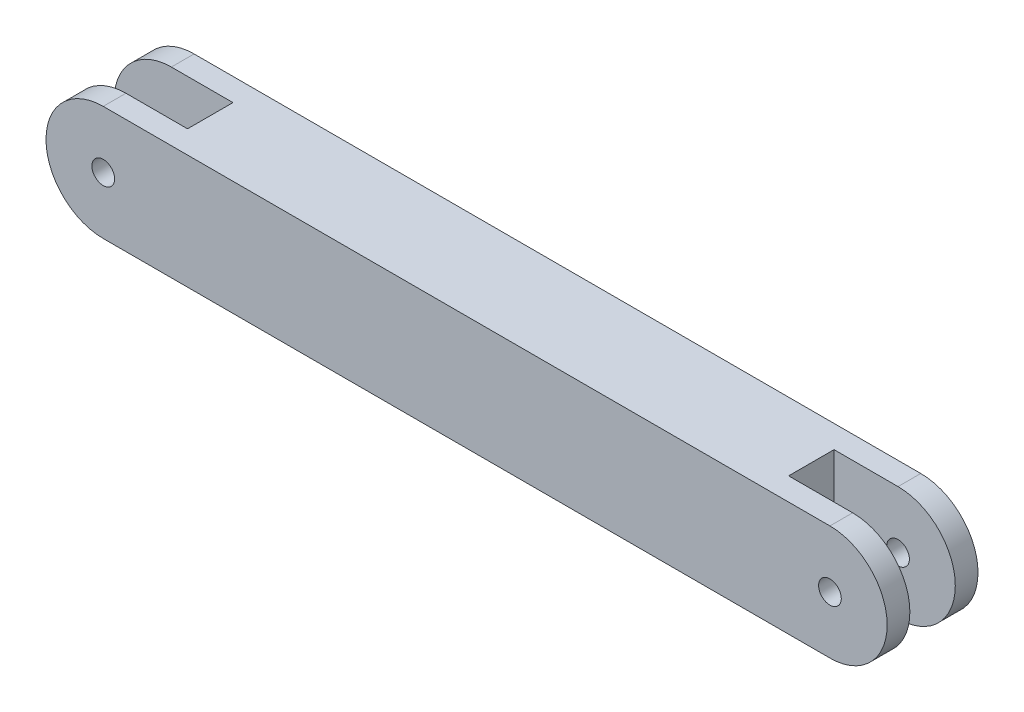
from build123d import *

# Parameters (mm, degrees)
SKETCH1_R           = 3.175
BOSS_EXTRUDE1_DEPTH = 6.35
SKETCH2_W           = 168.075192403
SKETCH2_H           = 32.004
BOSS_EXTRUDE2_DEPTH = 12.7
SKETCH5_R           = 3.175
BOSS_EXTRUDE3_DEPTH = 6.35


with BuildPart() as part:
    # Sketch1 → Boss-Extrude1 (new body)
    with BuildSketch(Plane.XY):
        with BuildLine():
            Line((-47.217391304, 7.923913043), (155.982608696, 7.923913043))
            ThreePointArc((155.982608696, 7.923913043), (171.984608696, -8.078086957), (155.982608696, -24.080086957))
            Line((155.982608696, -24.080086957), (-47.217391304, -24.080086957))
            ThreePointArc((-47.217391304, -24.080086957), (-63.219391304, -8.078086957), (-47.217391304, 7.923913043))
        make_face()
        with Locations((-47.217391304, -8.078086957)):
            Circle(SKETCH1_R, mode=Mode.SUBTRACT)
        with Locations((155.982608696, -8.078086957)):
            Circle(SKETCH1_R, mode=Mode.SUBTRACT)
    extrude(amount=BOSS_EXTRUDE1_DEPTH)

    # Sketch2 → Boss-Extrude2 (add)
    with BuildSketch(Plane.XY.offset(6.35)):
        with Locations((54.045012495, -8.078086957)):
            Rectangle(SKETCH2_W, SKETCH2_H)
    extrude(amount=BOSS_EXTRUDE2_DEPTH)

    # Sketch5 → Boss-Extrude3 (add)
    with BuildSketch(Plane.XY.offset(19.05)):
        with BuildLine():
            Line((-47.217391304, 7.923913043), (155.982608696, 7.923913043))
            ThreePointArc((155.982608696, 7.923913043), (171.984608696, -8.078086957), (155.982608696, -24.080086957))
            Line((155.982608696, -24.080086957), (-47.217391304, -24.080086957))
            ThreePointArc((-47.217391304, -24.080086957), (-63.219391304, -8.078086957), (-47.217391304, 7.923913043))
        make_face()
        with Locations((-47.217391304, -8.078086957)):
            Circle(SKETCH5_R, mode=Mode.SUBTRACT)
        with Locations((155.982608696, -8.078086957)):
            Circle(SKETCH5_R, mode=Mode.SUBTRACT)
    extrude(amount=BOSS_EXTRUDE3_DEPTH)


solid = part.part
